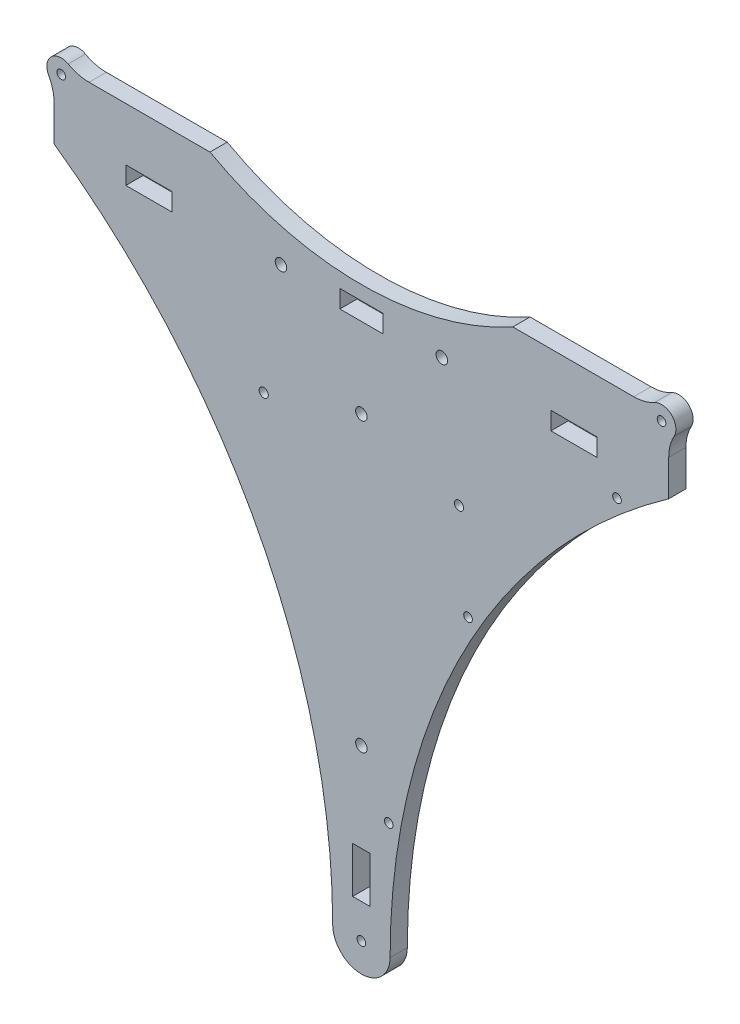
from build123d import *

# Parameters (mm, degrees)
SKETCH1_R           = 1.5
SKETCH1_R_2         = 2
SKETCH1_R_3         = 1.6
SKETCH1_W           = 16
SKETCH1_H           = 6.2
SKETCH1_W_2         = 6.1
SKETCH1_H_2         = 16
SKETCH1_W_3         = 15
BOSS_EXTRUDE1_DEPTH = 6
SKETCH2_R           = 1.5
CUT_EXTRUDE1_DEPTH  = 159.544946309


with BuildPart() as part:
    # Sketch1 → Boss-Extrude1 (new body)
    with BuildSketch(Plane.XY):
        with BuildLine():
            Line((86.201143473, 107), (94.817541634, 107))
            ThreePointArc((94.817541634, 107), (98.567541634, 107.476312452), (102.079385409, 108.875))
            ThreePointArc((102.079385409, 108.875), (108.035533906, 108.035533906), (108.875, 102.079385409))
            ThreePointArc((108.875, 102.079385409), (107.476312452, 98.567541634), (107, 94.817541634))
            Line((107, 94.817541634), (107, 82.3))
            ThreePointArc((107, 82.3), (35.695621125, 0.741674255), (10, -104.5))
            ThreePointArc((10, -104.5), (0, -114.5), (-10, -104.5))
            ThreePointArc((-10, -104.5), (-35.695621125, 0.741674255), (-107, 82.3))
            Line((-107, 82.3), (-107, 94.817541634))
            ThreePointArc((-107, 94.817541634), (-107.476312452, 98.567541634), (-108.875, 102.079385409))
            ThreePointArc((-108.875, 102.079385409), (-108.035533906, 108.035533906), (-102.079385409, 108.875))
            ThreePointArc((-102.079385409, 108.875), (-98.567541634, 107.476312452), (-94.817541634, 107))
            Line((-94.817541634, 107), (-91.798856527, 107))
            Line((-91.798856527, 107), (-52.717063467, 107))
            ThreePointArc((-52.717063467, 107), (0, 93.4), (52.717063467, 107))
            Line((52.717063467, 107), (86.201143473, 107))
        make_face()
        with Locations((-104.5, 104.5)):
            Circle(SKETCH1_R, mode=Mode.SUBTRACT)
        with Locations((104.5, 104.5)):
            Circle(SKETCH1_R, mode=Mode.SUBTRACT)
        with Locations((-28, 85.4)):
            Circle(SKETCH1_R_2, mode=Mode.SUBTRACT)
        with Locations((-34, 43.8)):
            Circle(SKETCH1_R_3, mode=Mode.SUBTRACT)
        with Locations((0, 54.4)):
            Circle(SKETCH1_R_2, mode=Mode.SUBTRACT)
        with Locations((0, -104.5)):
            Circle(SKETCH1_R, mode=Mode.SUBTRACT)
        with Locations((0, -45.6)):
            Circle(SKETCH1_R_2, mode=Mode.SUBTRACT)
        with Locations((28, 85.4)):
            Circle(SKETCH1_R_2, mode=Mode.SUBTRACT)
        with Locations((34, 43.8)):
            Circle(SKETCH1_R_3, mode=Mode.SUBTRACT)
        with Locations((-74, 85.4)):
            Rectangle(SKETCH1_W, SKETCH1_H, mode=Mode.SUBTRACT)
        with Locations((74, 85.4)):
            Rectangle(SKETCH1_W, SKETCH1_H, mode=Mode.SUBTRACT)
        with Locations((0, -84.6)):
            Rectangle(SKETCH1_W_2, SKETCH1_H_2, mode=Mode.SUBTRACT)
        with Locations((0, 85.4)):
            Rectangle(SKETCH1_W_3, SKETCH1_H, mode=Mode.SUBTRACT)
    extrude(amount=BOSS_EXTRUDE1_DEPTH)

    # Sketch2 → Cut-Extrude1 (cut, through all)
    with BuildSketch(Plane.XY.offset(6)):
        with Locations((9.530180145, -64.149856306)):
            Circle(SKETCH2_R)
        with Locations((37.131304004, 11.683608247)):
            Circle(SKETCH2_R)
        with Locations((89.004448835, 73.503614959)):
            Circle(SKETCH2_R)
    extrude(amount=-CUT_EXTRUDE1_DEPTH, mode=Mode.SUBTRACT)


solid = part.part
